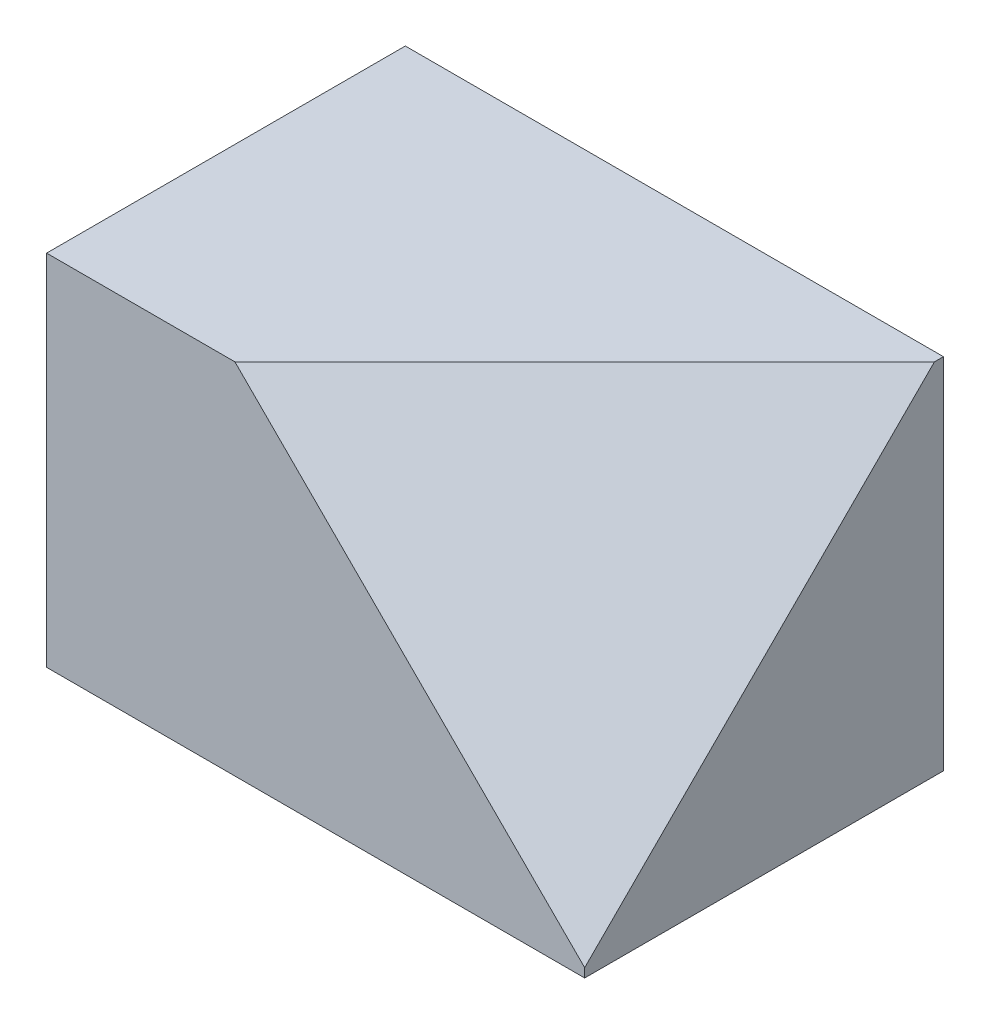
from build123d import *

# Parameters (mm, degrees)
CROQUIS1_W              = 60
CROQUIS1_H              = 40
SALIENTE_EXTRUIR1_DEPTH = 40
CHAFL_N1_START          = -14.142135624
CHAFL_N1_DEPTH          = 56.568542495


with BuildPart() as part:
    # Croquis1 → Saliente-Extruir1 (new body)
    with BuildSketch(Plane(origin=(0, 0, 0), x_dir=(1, 0, 0), z_dir=(0, 1, 0))):
        Rectangle(CROQUIS1_W, CROQUIS1_H)
    extrude(amount=SALIENTE_EXTRUIR1_DEPTH)

    # Chaflán1: read off the stored shape, not the designer's step
    # Chaflán1 outline → Chaflán1 (cut)
    with BuildSketch(Plane(origin=(0, 0, 0), x_dir=(1, 0, 0), z_dir=(0, 0.7071067811865476, -0.7071067811865476)).offset(CHAFL_N1_START)):
        Polygon((30, -14.849242405), (-9, -42.426406871), (-10, -43.133513652), (-10, -44), (30, -44), align=None)
    extrude(amount=CHAFL_N1_DEPTH, mode=Mode.SUBTRACT)


solid = part.part
